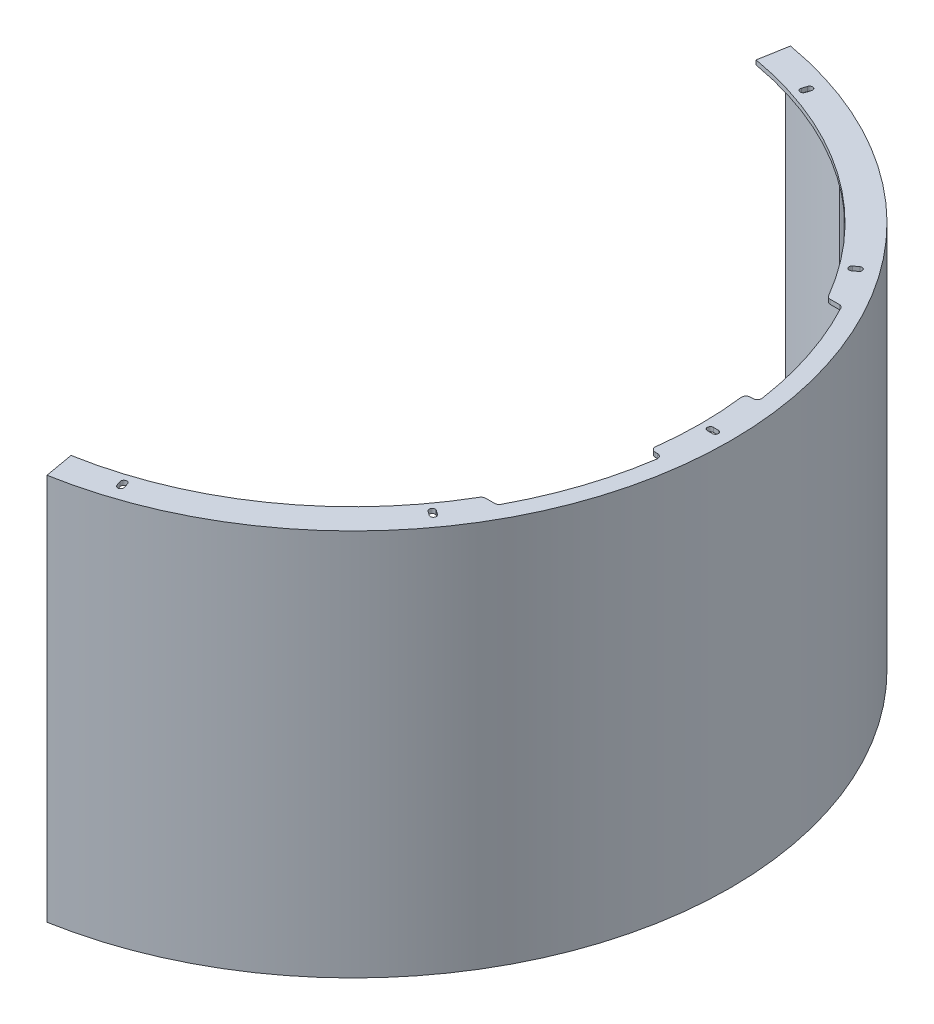
from build123d import *

# Parameters (mm, degrees)
BOSS_EXTRUDE1_DEPTH   = 255
BOSS_EXTRUDE2_DEPTH   = 255
BOSS_EXTRUDE2_2_DEPTH = 255
BOSS_EXTRUDE2_3_DEPTH = 255
BOSS_EXTRUDE2_4_DEPTH = 255
BOSS_EXTRUDE2_5_DEPTH = 255
BOSS_EXTRUDE2_6_DEPTH = 255
BOSS_EXTRUDE2_7_DEPTH = 255
BOSS_EXTRUDE2_8_DEPTH = 255
BOSS_EXTRUDE3_DEPTH   = 3
CUT_EXTRUDE3_DEPTH    = 5
LPATTERN1_COUNT       = 2
LPATTERN1_PITCH       = 258
LPATTERN2_COUNT       = 2
LPATTERN2_PITCH       = 258
CUT_EXTRUDE7_DEPTH    = 324
CUT_EXTRUDE10_DEPTH   = 5
FILLET2_R             = 3


with BuildPart() as part:
    # Sketch3 → Boss-Extrude1 (new body)
    with BuildSketch(Plane(origin=(0, 0, 0), x_dir=(1, 0, 0), z_dir=(0, 1, 0))):
        with BuildLine():
            ThreePointArc((0, 251.5), (251.5, 0), (0, -251.5))
            ThreePointArc((0, -251.5), (-21.919669301, -250.54296657), (-43.672516683, -247.679149883))
            Line((-43.672516683, -247.679149883), (-44.193461216, -250.633573142))
            ThreePointArc((-44.193461216, -250.633573142), (-22.181136529, -253.531550664), (0, -254.5))
            ThreePointArc((0, -254.5), (254.5, 0), (0, 254.5))
            ThreePointArc((0, 254.5), (-22.181136529, 253.531550664), (-44.193461216, 250.633573142))
            Line((-44.193461216, 250.633573142), (-43.672516683, 247.679149883))
            ThreePointArc((-43.672516683, 247.679149883), (-21.919669301, 250.54296657), (0, 251.5))
        make_face()
    extrude(amount=BOSS_EXTRUDE1_DEPTH)


with BuildPart() as body_2:
    # Sketch6 → Boss-Extrude2 (new body)
    with BuildSketch(Plane(origin=(0, 255, 0), x_dir=(1, 0, 0), z_dir=(0, 1, 0))):
        with BuildLine():
            Line((-2, 253.081926056), (-2, 247.081926056))
            ThreePointArc((-2, 247.081926056), (-1.707106781, 246.374819275), (-1, 246.081926056))
            Line((-1, 246.081926056), (1, 246.081926056))
            ThreePointArc((1, 246.081926056), (1.707106781, 246.374819275), (2, 247.081926056))
            Line((2, 247.081926056), (2, 253.081926056))
            Line((2, 253.081926056), (-2, 253.081926056))
        make_face()
    extrude(amount=-BOSS_EXTRUDE2_DEPTH)


with BuildPart() as body_3:
    # Sketch6 → Boss-Extrude2 2 (new body)
    with BuildSketch(Plane(origin=(0, 255, 0), x_dir=(1, 0, 0), z_dir=(0, 1, 0))):
        with BuildLine():
            Line((108.006194645, 228.886703884), (105.40289221, 223.480890676))
            ThreePointArc((105.40289221, 223.480890676), (105.359977747, 222.716727875), (105.869977339, 222.146038069))
            Line((105.869977339, 222.146038069), (107.671915074, 221.278270591))
            ThreePointArc((107.671915074, 221.278270591), (108.436077876, 221.235356129), (109.006767681, 221.74535572))
            Line((109.006767681, 221.74535572), (111.610070116, 227.151168927))
            Line((111.610070116, 227.151168927), (108.006194645, 228.886703884))
        make_face()
    extrude(amount=-BOSS_EXTRUDE2_2_DEPTH)


with BuildPart() as body_4:
    # Sketch6 → Boss-Extrude2 3 (new body)
    with BuildSketch(Plane(origin=(0, 255, 0), x_dir=(1, 0, 0), z_dir=(0, 1, 0))):
        with BuildLine():
            Line((196.620437831, 159.357662896), (191.929448936, 155.616724085))
            ThreePointArc((191.929448936, 155.616724085), (191.559226528, 154.946857078), (191.771107255, 154.2114028))
            Line((191.771107255, 154.2114028), (193.018086859, 152.647739835))
            ThreePointArc((193.018086859, 152.647739835), (193.687953865, 152.277517427), (194.423408143, 152.489398155))
            Line((194.423408143, 152.489398155), (199.114397038, 156.230336966))
            Line((199.114397038, 156.230336966), (196.620437831, 159.357662896))
        make_face()
    extrude(amount=-BOSS_EXTRUDE2_3_DEPTH)


with BuildPart() as body_5:
    # Sketch6 → Boss-Extrude2 4 (new body)
    with BuildSketch(Plane(origin=(0, 255, 0), x_dir=(1, 0, 0), z_dir=(0, 1, 0))):
        with BuildLine():
            Line((246.291591913, 58.265882378), (240.44202444, 56.930756774))
            ThreePointArc((240.44202444, 56.930756774), (239.817821175, 56.487860938), (239.689617462, 55.733307928))
            Line((239.689617462, 55.733307928), (240.13465933, 53.783452104))
            ThreePointArc((240.13465933, 53.783452104), (240.577555165, 53.159248838), (241.332108176, 53.031045125))
            Line((241.332108176, 53.031045125), (247.181675649, 54.366170729))
            Line((247.181675649, 54.366170729), (246.291591913, 58.265882378))
        make_face()
    extrude(amount=-BOSS_EXTRUDE2_4_DEPTH)


with BuildPart() as body_6:
    # Sketch6 → Boss-Extrude2 5 (new body)
    with BuildSketch(Plane(origin=(0, 255, 0), x_dir=(1, 0, 0), z_dir=(0, 1, 0))):
        with BuildLine():
            Line((247.181675649, -54.366170729), (241.332108176, -53.031045125))
            ThreePointArc((241.332108176, -53.031045125), (240.577555165, -53.159248838), (240.13465933, -53.783452104))
            Line((240.13465933, -53.783452104), (239.689617462, -55.733307928))
            ThreePointArc((239.689617462, -55.733307928), (239.817821175, -56.487860938), (240.44202444, -56.930756774))
            Line((240.44202444, -56.930756774), (246.291591913, -58.265882378))
            Line((246.291591913, -58.265882378), (247.181675649, -54.366170729))
        make_face()
    extrude(amount=-BOSS_EXTRUDE2_5_DEPTH)


with BuildPart() as body_7:
    # Sketch6 → Boss-Extrude2 6 (new body)
    with BuildSketch(Plane(origin=(0, 255, 0), x_dir=(1, 0, 0), z_dir=(0, 1, 0))):
        with BuildLine():
            Line((199.114397038, -156.230336966), (194.423408143, -152.489398155))
            ThreePointArc((194.423408143, -152.489398155), (193.687953865, -152.277517427), (193.018086859, -152.647739835))
            Line((193.018086859, -152.647739835), (191.771107255, -154.2114028))
            ThreePointArc((191.771107255, -154.2114028), (191.559226528, -154.946857078), (191.929448936, -155.616724085))
            Line((191.929448936, -155.616724085), (196.620437831, -159.357662896))
            Line((196.620437831, -159.357662896), (199.114397038, -156.230336966))
        make_face()
    extrude(amount=-BOSS_EXTRUDE2_6_DEPTH)


with BuildPart() as body_8:
    # Sketch6 → Boss-Extrude2 7 (new body)
    with BuildSketch(Plane(origin=(0, 255, 0), x_dir=(1, 0, 0), z_dir=(0, 1, 0))):
        with BuildLine():
            Line((111.610070116, -227.151168927), (109.006767681, -221.74535572))
            ThreePointArc((109.006767681, -221.74535572), (108.436077876, -221.235356129), (107.671915074, -221.278270591))
            Line((107.671915074, -221.278270591), (105.869977339, -222.146038069))
            ThreePointArc((105.869977339, -222.146038069), (105.359977747, -222.716727875), (105.40289221, -223.480890676))
            Line((105.40289221, -223.480890676), (108.006194645, -228.886703884))
            Line((108.006194645, -228.886703884), (111.610070116, -227.151168927))
        make_face()
    extrude(amount=-BOSS_EXTRUDE2_7_DEPTH)


with BuildPart() as body_9:
    # Sketch6 → Boss-Extrude2 8 (new body)
    with BuildSketch(Plane(origin=(0, 255, 0), x_dir=(1, 0, 0), z_dir=(0, 1, 0))):
        with BuildLine():
            Line((2, -253.081926056), (2, -247.081926056))
            ThreePointArc((2, -247.081926056), (1.707106781, -246.374819275), (1, -246.081926056))
            Line((1, -246.081926056), (-1, -246.081926056))
            ThreePointArc((-1, -246.081926056), (-1.707106781, -246.374819275), (-2, -247.081926056))
            Line((-2, -247.081926056), (-2, -253.081926056))
            Line((-2, -253.081926056), (2, -253.081926056))
        make_face()
    extrude(amount=-BOSS_EXTRUDE2_8_DEPTH)


with BuildPart() as body_2_1:
    add(body_2.part)

    # Combine2: union part, body 3, body 4, body 5, body 6, body 7, body 8, body 9
    add(part.part)
    add(body_3.part)
    add(body_4.part)
    add(body_5.part)
    add(body_6.part)
    add(body_7.part)
    add(body_8.part)
    add(body_9.part)

    # Sketch7 → Boss-Extrude3 (add)
    with BuildSketch(Plane(origin=(0, 255, 0), x_dir=(1, 0, 0), z_dir=(0, 1, 0))):
        with BuildLine():
            ThreePointArc((-44.193461216, -250.633573142), (254.5, 0), (-44.193461216, 250.633573142))
            Line((-44.193461216, 250.633573142), (-40.720497663, 230.937418081))
            ThreePointArc((-40.720497663, 230.937418081), (234.5, 0), (-40.720497663, -230.937418081))
            Line((-40.720497663, -230.937418081), (-44.193461216, -250.633573142))
        make_face()
    boss_extrude3 = extrude(amount=BOSS_EXTRUDE3_DEPTH)

    # Sketch8 → Cut-Extrude3 (cut)
    with BuildSketch(Plane.XZ.offset(-255)):
        with BuildLine():
            Line((240.8, 2), (244.2, 2))
            ThreePointArc((244.2, 2), (246.2, 0), (244.2, -2))
            Line((244.2, -2), (240.8, -2))
            ThreePointArc((240.8, -2), (238.8, 0), (240.8, 2))
        make_face()
        with BuildLine():
            Line((195.98686275, -139.920654763), (198.737520531, -141.919124621))
            ThreePointArc((198.737520531, -141.919124621), (199.179984015, -144.712729114), (196.386379522, -145.155192599))
            Line((196.386379522, -145.155192599), (193.635721741, -143.156722741))
            ThreePointArc((193.635721741, -143.156722741), (193.193258257, -140.363118247), (195.98686275, -139.920654763))
        make_face()
        with BuildLine():
            Line((76.313405278, -228.396375135), (77.364063059, -231.629967291))
            ThreePointArc((77.364063059, -231.629967291), (76.079984015, -234.150114312), (73.559836994, -232.866035268))
            Line((73.559836994, -232.866035268), (72.509179213, -229.632443113))
            ThreePointArc((72.509179213, -229.632443113), (73.793258257, -227.112296091), (76.313405278, -228.396375135))
        make_face()
        with BuildLine():
            Line((-72.509179213, -229.632443113), (-73.559836994, -232.866035268))
            ThreePointArc((-73.559836994, -232.866035268), (-76.079984015, -234.150114312), (-77.364063059, -231.629967291))
            Line((-77.364063059, -231.629967291), (-76.313405278, -228.396375135))
            ThreePointArc((-76.313405278, -228.396375135), (-73.793258257, -227.112296091), (-72.509179213, -229.632443113))
        make_face()
        with BuildLine():
            Line((-193.635721741, -143.156722741), (-196.386379522, -145.155192599))
            ThreePointArc((-196.386379522, -145.155192599), (-199.179984015, -144.712729114), (-198.737520531, -141.919124621))
            Line((-198.737520531, -141.919124621), (-195.98686275, -139.920654763))
            ThreePointArc((-195.98686275, -139.920654763), (-193.193258257, -140.363118247), (-193.635721741, -143.156722741))
        make_face()
        with BuildLine():
            Line((-240.8, -2), (-244.2, -2))
            ThreePointArc((-244.2, -2), (-246.2, 0), (-244.2, 2))
            Line((-244.2, 2), (-240.8, 2))
            ThreePointArc((-240.8, 2), (-238.8, 0), (-240.8, -2))
        make_face()
        with BuildLine():
            Line((-195.98686275, 139.920654763), (-198.737520531, 141.919124621))
            ThreePointArc((-198.737520531, 141.919124621), (-199.179984015, 144.712729114), (-196.386379522, 145.155192599))
            Line((-196.386379522, 145.155192599), (-193.635721741, 143.156722741))
            ThreePointArc((-193.635721741, 143.156722741), (-193.193258257, 140.363118247), (-195.98686275, 139.920654763))
        make_face()
        with BuildLine():
            Line((-76.313405278, 228.396375135), (-77.364063059, 231.629967291))
            ThreePointArc((-77.364063059, 231.629967291), (-76.079984015, 234.150114312), (-73.559836994, 232.866035268))
            Line((-73.559836994, 232.866035268), (-72.509179213, 229.632443113))
            ThreePointArc((-72.509179213, 229.632443113), (-73.793258257, 227.112296091), (-76.313405278, 228.396375135))
        make_face()
        with BuildLine():
            Line((72.509179213, 229.632443113), (73.559836994, 232.866035268))
            ThreePointArc((73.559836994, 232.866035268), (76.079984015, 234.150114312), (77.364063059, 231.629967291))
            Line((77.364063059, 231.629967291), (76.313405278, 228.396375135))
            ThreePointArc((76.313405278, 228.396375135), (73.793258257, 227.112296091), (72.509179213, 229.632443113))
        make_face()
        with BuildLine():
            Line((193.635721741, 143.156722741), (196.386379522, 145.155192599))
            ThreePointArc((196.386379522, 145.155192599), (199.179984015, 144.712729114), (198.737520531, 141.919124621))
            Line((198.737520531, 141.919124621), (195.98686275, 139.920654763))
            ThreePointArc((195.98686275, 139.920654763), (193.193258257, 140.363118247), (193.635721741, 143.156722741))
        make_face()
    cut_extrude3 = extrude(amount=-CUT_EXTRUDE3_DEPTH, mode=Mode.SUBTRACT)

    # LPattern1: Boss-Extrude3 ×2
    with Locations(*[(0, -i * LPATTERN1_PITCH, 0) for i in range(1, LPATTERN1_COUNT)]):
        add(boss_extrude3)

    # LPattern2: Cut-Extrude3 ×2
    with Locations(*[(0, -i * LPATTERN2_PITCH, 0) for i in range(1, LPATTERN2_COUNT)]):
        add(cut_extrude3, mode=Mode.SUBTRACT)

    # Sketch11 → Cut-Extrude7 (cut)
    with BuildSketch(Plane(origin=(0, 258, 0), x_dir=(1, 0, 0), z_dir=(0, 1, 0))):
        with BuildLine():
            Line((-44.193461216, 250.633573142), (0, 0))
            Line((0, 0), (44.193461216, 250.633573142))
            ThreePointArc((44.193461216, 250.633573142), (0, 254.5), (-44.193461216, 250.633573142))
        make_face()
    cut_extrude7 = extrude(amount=-CUT_EXTRUDE7_DEPTH, mode=Mode.SUBTRACT)

    # Mirror1: Cut-Extrude7 across plane
    add(cut_extrude7.mirror(Plane.XY), mode=Mode.SUBTRACT)

    # Sketch13 → Cut-Extrude10 (cut)
    with BuildSketch(Plane(origin=(0, 258, 0), x_dir=(1, 0, 0), z_dir=(0, 1, 0))):
        with BuildLine():
            Line((240.8, 32.135476301), (189.842924972, 32.135476301))
            Line((189.842924972, 32.135476301), (189.842924972, 116.171040312))
            Line((189.842924972, 116.171040312), (213.357957972, 116.171040312))
            ThreePointArc((213.357957972, 116.171040312), (230.93366299, 75.412015854), (240.8, 32.135476301))
        make_face()
        with BuildLine():
            Line((189.842924972, -116.171040312), (213.357957972, -116.171040312))
            ThreePointArc((213.357957972, -116.171040312), (230.93366299, -75.412015854), (240.8, -32.135476301))
            Line((240.8, -32.135476301), (189.842924972, -32.135476301))
            Line((189.842924972, -32.135476301), (189.842924972, -116.171040312))
        make_face()
    extrude(amount=-CUT_EXTRUDE10_DEPTH, mode=Mode.SUBTRACT)

    # Fillet2
    fillet2_edges = [body_2_1.edges().sort_by_distance(p)[0] for p in [
        (203.702084901, 256.5, 116.171040312),
        (213.357957972, 256.5, 116.171040312),
        (232.287668986, 256.5, 32.135476301),
        (240.8, 256.5, 32.135476301),
        (232.287668986, 256.5, -32.135476301),
        (240.8, 256.5, -32.135476301),
        (213.357957972, 256.5, -116.171040312),
        (203.702084901, 256.5, -116.171040312),
    ]]
    fillet(fillet2_edges, radius=FILLET2_R)


solid = body_2_1.part
